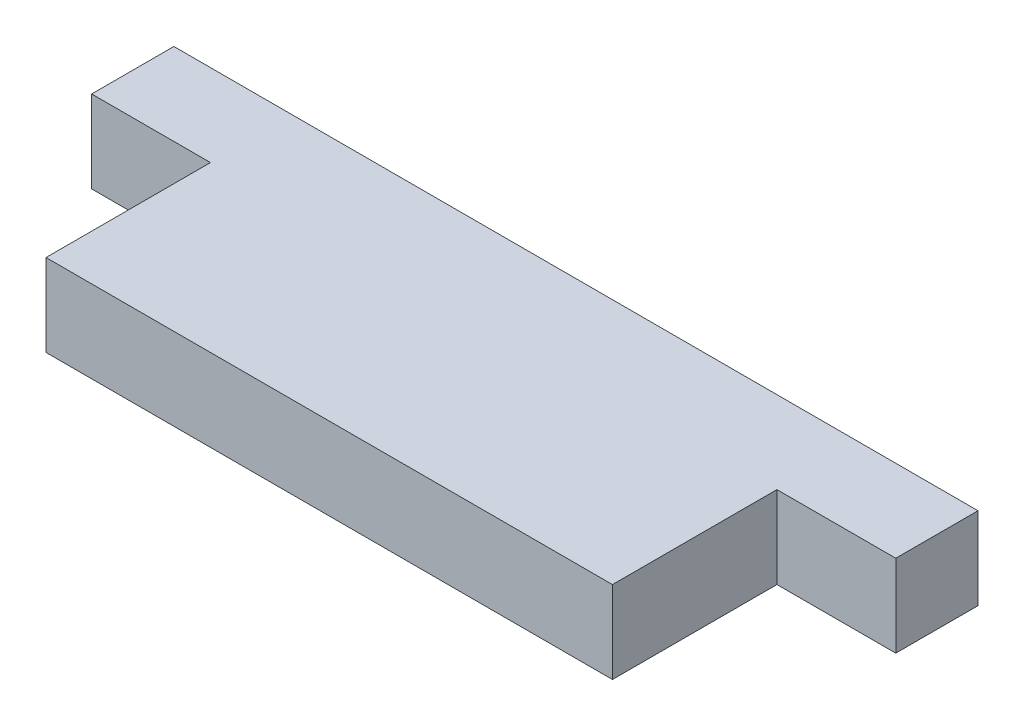
from build123d import *

# Parameters (mm, degrees)
BOSS_EXTRUDE1_DEPTH = 6.35


with BuildPart() as part:
    # Sketch1 → Boss-Extrude1 (new body)
    with BuildSketch(Plane(origin=(0, 0, 0), x_dir=(1, 0, 0), z_dir=(0, 1, 0))):
        Polygon((0, 0), (0, 12.7), (-9.1750896, 12.7), (-9.1750896, 19.05), (52.915089496, 19.05), (52.915089496, 12.7), (43.739999896, 12.7), (43.739999896, 0), align=None)
    extrude(amount=BOSS_EXTRUDE1_DEPTH)


solid = part.part
